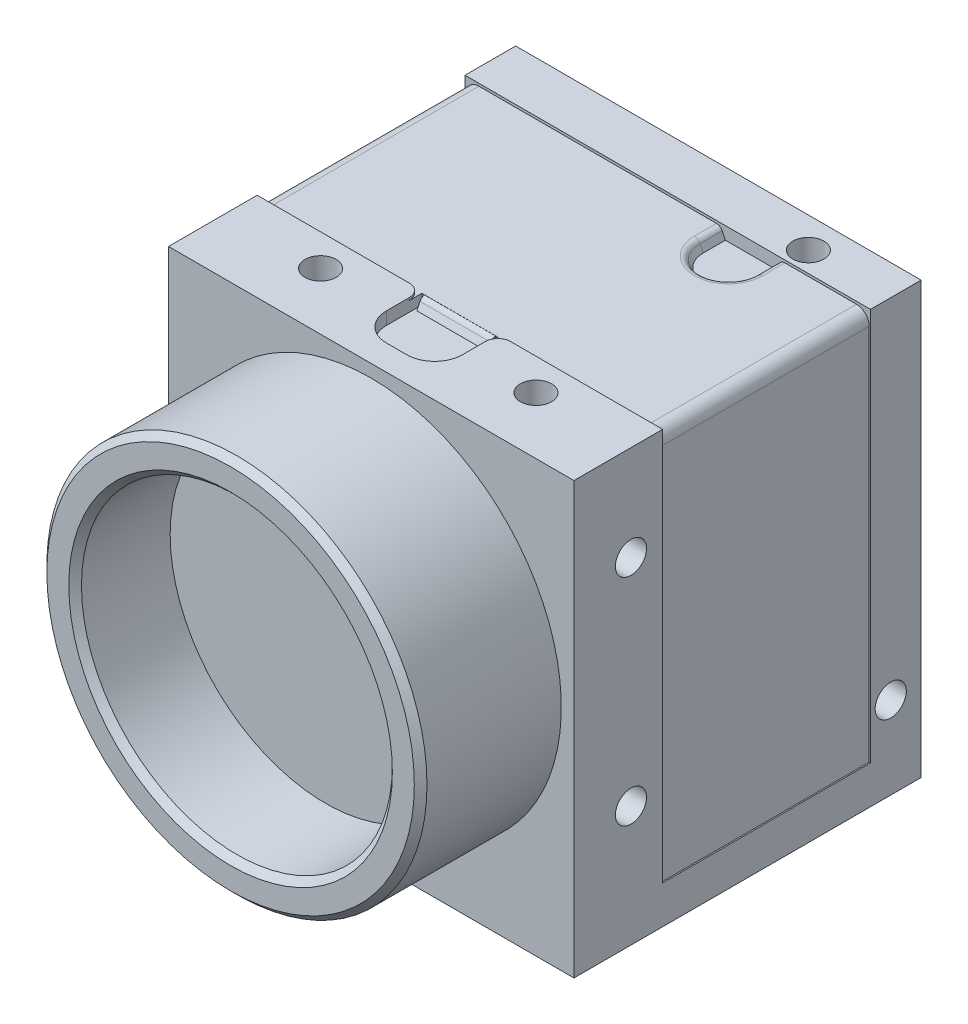
from build123d import *

# Parameters (mm, degrees)
SKETCH1_W                                          = 32
SKETCH1_H                                          = 34
BOSS_EXTRUDE1_DEPTH                                = 27.4
SKETCH2_W                                          = 20.4
SKETCH2_H                                          = 0.2
CUT_EXTRUDE1_DEPTH                                 = 53.304493115
SKETCH3_W                                          = 6
SKETCH3_H                                          = 5
CUT_EXTRUDE2_DEPTH                                 = 0.2
SKETCH4_W                                          = 6
SKETCH4_H                                          = 5
CUT_EXTRUDE3_DEPTH                                 = 0.8
SKETCH5_W                                          = 32
SKETCH5_H                                          = 4
BOSS_EXTRUDE2_DEPTH                                = 0.2
CUT_EXTRUDE4_DEPTH                                 = 0.8
CUT_EXTRUDE5_REACH                                 = 46.359
SKETCH8_W                                          = 0.1
SKETCH8_H                                          = 16.4
CUT_EXTRUDE6_REACH                                 = 46.359
SKETCH10_W                                         = 0.1
SKETCH10_H                                         = 16.4
BOSS_EXTRUDE3_DEPTH                                = 2.8
CUT_EXTRUDE7_DEPTH                                 = 4.8
SKETCH13_W                                         = 27
SKETCH13_H                                         = 10
CUT_EXTRUDE8_DEPTH                                 = 0.5
CUT_EXTRUDE9_DEPTH                                 = 1.8
SKETCH15_W                                         = 8.3
SKETCH15_H                                         = 5.1
CUT_EXTRUDE10_DEPTH                                = 4
DRAFT1_ANGLE                                       = 25.765480369
SKETCH16_W                                         = 15
SKETCH16_H                                         = 11.1
F_2_5_2_5_DIAMETER_HOLE1_D                         = 2.5
F_2_5_2_5_DIAMETER_HOLE1_DEPTH                     = 4
F_1_6_1_6_DIAMETER_HOLE1_D                         = 1.6
F_1_6_1_6_DIAMETER_HOLE1_DEPTH                     = 4
F_6_0_6_DIAMETER_HOLE1_D                           = 6
F_6_0_6_DIAMETER_HOLE1_DEPTH                       = 1.8
HOLE1_D                                            = 1.567
HOLE1_DEPTH                                        = 6.2
HOLE2_D                                            = 1.567
HOLE2_DEPTH                                        = 6.5
M2_CLEARANCE_HOLE1_D                               = 2.459
M2_CLEARANCE_HOLE1_DEPTH                           = 6.5
M2_CLEARANCE_HOLE2_D                               = 2.459
M2_CLEARANCE_HOLE2_DEPTH                           = 6.5
CBORE_FOR_M2_5_HEX_HEAD_MACHINE_SCREW1_D           = 2.8
CBORE_FOR_M2_5_HEX_HEAD_MACHINE_SCREW1_DEPTH       = 4
CBORE_FOR_M2_5_HEX_HEAD_MACHINE_SCREW1_CBORE_D     = 3.2
CBORE_FOR_M2_5_HEX_HEAD_MACHINE_SCREW1_CBORE_DEPTH = 0.45
M2_CLEARANCE_HOLE3_D                               = 2.459
M2_CLEARANCE_HOLE3_DEPTH                           = 38.5
M2_CLEARANCE_HOLE4_D                               = 2.459
M2_CLEARANCE_HOLE4_DEPTH                           = 6.5
M22_CLEARANCE_HOLE1_D                              = 24.5364
M22_CLEARANCE_HOLE1_DEPTH                          = 7.5
RIB1_START                                         = -2.8
RIB1_DEPTH                                         = 5.6
FILLET1_R                                          = 1.35
CHAMFER1_SIZE                                      = 0.5
CHAMFER2_SIZE                                      = 0.3
FILLET2_R                                          = 0.5
FILLET3_R                                          = 1
FILLET4_R                                          = 2
FILLET5_R                                          = 2.2


# Read off the part's stored shape, not the designer's step: Rib1
with BuildPart() as part:
    # Sketch1 → Boss-Extrude1 (new body)
    with BuildSketch(Plane(origin=(0, 0, -27.4), x_dir=(-1, 0, 0), z_dir=(0, 0, -1))):
        with Locations((0, 14)):
            Rectangle(SKETCH1_W, SKETCH1_H)
    extrude(amount=-BOSS_EXTRUDE1_DEPTH)

    # Sketch2 → Cut-Extrude1 (cut, through all)
    with BuildSketch(Plane.ZY.offset(16)):
        with Locations((-17.2, 30.9)):
            Rectangle(SKETCH2_W, SKETCH2_H)
    extrude(amount=-CUT_EXTRUDE1_DEPTH, mode=Mode.SUBTRACT)

    # Sketch3 → Cut-Extrude2 (cut)
    with BuildSketch(Plane(origin=(0, 31, 0), x_dir=(-1, 0, 0), z_dir=(0, 1, 0))):
        with Locations((0, -4.5)):
            Rectangle(SKETCH3_W, SKETCH3_H)
    extrude(amount=-CUT_EXTRUDE2_DEPTH, mode=Mode.SUBTRACT)

    # Sketch4 → Cut-Extrude3 (cut)
    with BuildSketch(Plane(origin=(0, 30.8, 0), x_dir=(-1, 0, 0), z_dir=(0, 1, 0))):
        with Locations((0, -4.5)):
            Rectangle(SKETCH4_W, SKETCH4_H)
    extrude(amount=-CUT_EXTRUDE3_DEPTH, mode=Mode.SUBTRACT)

    # Sketch5 → Boss-Extrude2 (add)
    with BuildSketch(Plane(origin=(0, 30.8, 0), x_dir=(-1, 0, 0), z_dir=(0, 1, 0))):
        with Locations((0, -25.4)):
            Rectangle(SKETCH5_W, SKETCH5_H)
    extrude(amount=BOSS_EXTRUDE2_DEPTH)

    # Sketch6 → Cut-Extrude4 (cut)
    with BuildSketch(Plane(origin=(0, 30.8, 0), x_dir=(-1, 0, 0), z_dir=(0, 1, 0))):
        with BuildLine():
            Line((-8.936140662, -21.65), (-8.936140662, -23.4))
            Line((-8.936140662, -23.4), (-4.163859338, -23.4))
            Line((-4.163859338, -23.4), (-4.163859338, -21.65))
            ThreePointArc((-4.163859338, -21.65), (-6.55, -19.263859338), (-8.936140662, -21.65))
        make_face()
    extrude(amount=-CUT_EXTRUDE4_DEPTH, mode=Mode.SUBTRACT)

    # Sketch8 → Cut-Extrude5 (cut, up to next)
    with BuildSketch(Plane.XZ, mode=Mode.PRIVATE) as cut_extrude5_sk1:
        with Locations((-15.95, -15.2)):
            Rectangle(SKETCH8_W, SKETCH8_H)
    cut_extrude5_tool1 = extrude(cut_extrude5_sk1.sketch, amount=-CUT_EXTRUDE5_REACH, mode=Mode.PRIVATE) & part.part
    add(cut_extrude5_tool1.solids().sort_by_distance((-15.95, 0, -15.2))[0], mode=Mode.SUBTRACT)

    # Sketch10 → Cut-Extrude6 (cut, up to next)
    with BuildSketch(Plane.XZ, mode=Mode.PRIVATE) as cut_extrude6_sk1:
        with Locations((15.95, -15.2)):
            Rectangle(SKETCH10_W, SKETCH10_H)
    cut_extrude6_tool1 = extrude(cut_extrude6_sk1.sketch, amount=-CUT_EXTRUDE6_REACH, mode=Mode.PRIVATE) & part.part
    add(cut_extrude6_tool1.solids().sort_by_distance((15.95, 0, -15.2))[0], mode=Mode.SUBTRACT)

    # Sketch11 → Boss-Extrude3 (add)
    with BuildSketch(Plane(origin=(0, 0, -27.4), x_dir=(-1, 0, 0), z_dir=(0, 0, -1))):
        with BuildLine():
            Line((13.7, 19.69), (13.7, 14.61))
            ThreePointArc((13.7, 14.61), (12.625054144, 12.748076643), (10.47510829, 12.747982865))
            Line((10.47510829, 12.747982865), (8.3, 14.003613559))
            Line((8.3, 14.003613559), (8.3, 20.296386441))
            Line((8.3, 20.296386441), (10.47510829, 21.552017135))
            ThreePointArc((10.47510829, 21.552017135), (12.625054144, 21.551923357), (13.7, 19.69))
        make_face()
    extrude(amount=BOSS_EXTRUDE3_DEPTH)

    # Sketch12 → Cut-Extrude7 (cut)
    with BuildSketch(Plane(origin=(0, 0, -30.2), x_dir=(-1, 0, 0), z_dir=(0, 0, -1))):
        with BuildLine():
            Line((12.9, 14.61), (12.9, 19.69))
            ThreePointArc((12.9, 19.69), (12.225033997, 20.859114666), (10.875067996, 20.85917355))
            Line((10.875067996, 20.85917355), (9.1, 19.834475207))
            Line((9.1, 19.834475207), (9.1, 14.465524793))
            Line((9.1, 14.465524793), (10.875067996, 13.44082645))
            ThreePointArc((10.875067996, 13.44082645), (12.225033997, 13.440885334), (12.9, 14.61))
        make_face()
    extrude(amount=-CUT_EXTRUDE7_DEPTH, mode=Mode.SUBTRACT)

    # Sketch13 → Cut-Extrude8 (cut)
    with BuildSketch(Plane.XZ.offset(3)):
        with Locations((0, -14.5)):
            Rectangle(SKETCH13_W, SKETCH13_H)
    extrude(amount=-CUT_EXTRUDE8_DEPTH, mode=Mode.SUBTRACT)

    # Sketch14 → Cut-Extrude9 (cut)
    with BuildSketch(Plane.XZ.offset(3)):
        with BuildLine():
            Line((3, -27.4), (3, -25))
            ThreePointArc((3, -25), (0, -22), (-3, -25))
            Line((-3, -25), (-3, -27.4))
            Line((-3, -27.4), (3, -27.4))
        make_face()
    extrude(amount=-CUT_EXTRUDE9_DEPTH, mode=Mode.SUBTRACT)

    # Sketch15 → Cut-Extrude10 (cut)
    with BuildSketch(Plane(origin=(0, 0, -27.4), x_dir=(-1, 0, 0), z_dir=(0, 0, -1))):
        with Locations((0, 26.8)):
            Rectangle(SKETCH15_W, SKETCH15_H)
    extrude(amount=-CUT_EXTRUDE10_DEPTH, mode=Mode.SUBTRACT)

    # Draft1
    draft1_faces = [part.faces().sort_by_distance(p)[0] for p in [
        (6.55, 30.4, -19.263859338),
        (8.936140662, 30.4, -22.525),
        (4.163859338, 30.4, -22.525),
    ]]
    draft(draft1_faces, Plane(origin=(16, 30.8, -27.4), x_dir=(0, 0, 1), z_dir=(0, 1, 0)), DRAFT1_ANGLE)

    # Sketch16 → Revolve1 (revolve)
    with BuildSketch(Plane.XZ.offset(-15), mode=Mode.PRIVATE) as revolve1_sk:
        with Locations((7.5, 5.55)):
            Rectangle(SKETCH16_W, SKETCH16_H)
    revolve(revolve1_sk.sketch.rotate(Axis((0, 15, 11.1), (0, 0, -1)), 270), axis=Axis((0, 15, 11.1), (0, 0, -1)))

    # Ø2.5 (2.5) Diameter Hole1
    with Locations(Plane(origin=(0, 0, -27.4), x_dir=(-1, 0, 0), z_dir=(0, 0, -1))):
        with Locations((-1.6, 13.05)):
            Hole(F_2_5_2_5_DIAMETER_HOLE1_D / 2, depth=F_2_5_2_5_DIAMETER_HOLE1_DEPTH)

    # Ø1.6 (1.6) Diameter Hole1
    with Locations(Plane(origin=(0, 0, -27.4), x_dir=(-1, 0, 0), z_dir=(0, 0, -1))):
        with Locations((11, 24.325), (11, 9.975)):
            Hole(F_1_6_1_6_DIAMETER_HOLE1_D / 2, depth=F_1_6_1_6_DIAMETER_HOLE1_DEPTH)

    # Ø6.0 (6) Diameter Hole1
    with Locations(Plane.XZ.offset(3)):
        with Locations((0, -4)):
            Hole(F_6_0_6_DIAMETER_HOLE1_D / 2, depth=F_6_0_6_DIAMETER_HOLE1_DEPTH)

    # Hole1
    with Locations(Plane.XZ.offset(3)):
        with Locations((-6, -24.5), (6, -24.5)):
            Hole(HOLE1_D / 2, depth=HOLE1_DEPTH)

    # Hole2
    with Locations(Plane.XZ.offset(3)):
        with Locations((6, -2.5), (-6, -2.5)):
            Hole(HOLE2_D / 2, depth=HOLE2_DEPTH)

    # M2 Clearance Hole1
    with Locations(Plane(origin=(16, 0, 0), x_dir=(0, 0, -1), z_dir=(1, 0, 0))):
        with Locations((4.5, 6.5)):
            Hole(M2_CLEARANCE_HOLE1_D / 2, depth=M2_CLEARANCE_HOLE1_DEPTH)

    # M2 Clearance Hole2
    with Locations(Plane.XZ.offset(3)):
        with Locations((-9.5, -25), (9.5, -25), (8.5, -4.5), (-8.5, -4.5)):
            Hole(M2_CLEARANCE_HOLE2_D / 2, depth=M2_CLEARANCE_HOLE2_DEPTH)

    # CBORE for M2.5 Hex Head Machine Screw1
    with Locations(Plane(origin=(0, 0, -27.4), x_dir=(-1, 0, 0), z_dir=(0, 0, -1))):
        with Locations((-6.9, 23.25)):
            CounterBoreHole(CBORE_FOR_M2_5_HEX_HEAD_MACHINE_SCREW1_D / 2, CBORE_FOR_M2_5_HEX_HEAD_MACHINE_SCREW1_CBORE_D / 2, CBORE_FOR_M2_5_HEX_HEAD_MACHINE_SCREW1_CBORE_DEPTH, depth=CBORE_FOR_M2_5_HEX_HEAD_MACHINE_SCREW1_DEPTH)

    # M2 Clearance Hole3
    with Locations(Plane.ZY.offset(16)):
        with Locations((-4.5, 23.5), (-4.5, 6.5), (-25, 3.5)):
            Hole(M2_CLEARANCE_HOLE3_D / 2, depth=M2_CLEARANCE_HOLE3_DEPTH)

    # M2 Clearance Hole4
    with Locations(Plane(origin=(0, 31, 0), x_dir=(-1, 0, 0), z_dir=(0, 1, 0))):
        with Locations((8.5, -4.5), (-8.5, -4.5), (-9.5, -25)):
            Hole(M2_CLEARANCE_HOLE4_D / 2, depth=M2_CLEARANCE_HOLE4_DEPTH)

    # M22 Clearance Hole1
    with Locations(Plane.XY.offset(11.1)):
        with Locations((0, 15)):
            Hole(M22_CLEARANCE_HOLE1_D / 2, depth=M22_CLEARANCE_HOLE1_DEPTH)

    # Rib1 outline → Rib1 (add)
    with BuildSketch(Plane(origin=(0, 0, 0), x_dir=(0, 0, -1), z_dir=(1, 0, 0)).offset(RIB1_START)):
        with BuildLine():
            ThreePointArc((7, 30.789897949), (6.792955609, 30.694618477), (6.649709587, 30.517344298))
            Line((6.649709587, 30.517344298), (6.4, 30))
            Line((6.4, 30), (7, 30))
            Line((7, 30), (7, 30.789897949))
        make_face()
    extrude(amount=RIB1_DEPTH)

    # Fillet1
    fillet1_edges = [part.edges().sort_by_distance(p)[0] for p in [
        (-9.1, 14.465524793, -27.8),
        (-9.1, 19.834475207, -27.8),
    ]]
    fillet(fillet1_edges, radius=FILLET1_R)

    # Chamfer1
    chamfer1_edges = [part.edges().sort_by_distance(p)[0] for p in [
        (0, 0, 11.1),
        (12.2682, 15, 11.1),
    ]]
    chamfer(chamfer1_edges, length=CHAMFER1_SIZE)

    # Chamfer2
    chamfer2_edges = [part.edges().sort_by_distance(p)[0] for p in [
        (-12.225033997, 13.440885334, -30.2),
        (-12.9, 17.15, -30.2),
        (-12.225033997, 20.859114666, -30.2),
        (-10.325067996, 20.54167355, -30.2),
        (-9.1, 17.15, -30.2),
        (-10.325067996, 13.75832645, -30.2),
        (-9.280885334, 19.730033997, -30.2),
        (-9.280885334, 14.569966003, -30.2),
    ]]
    chamfer(chamfer2_edges, length=CHAMFER2_SIZE)

    # Fillet2
    fillet2_edges = [part.edges().sort_by_distance(p)[0] for p in [
        (6.55, 30.8, -19.263859338),
        (8.936140662, 30.8, -22.525),
        (4.163859338, 30.8, -22.525),
    ]]
    fillet(fillet2_edges, radius=FILLET2_R)

    # Fillet3
    fillet3_edges = [part.edges().sort_by_distance(p)[0] for p in [
        (-4.15, 24.25, -25.4),
        (4.15, 24.25, -25.4),
        (4.15, 29.35, -25.4),
        (-4.15, 29.35, -25.4),
        (-3, 30.9, -7),
        (3, 30.9, -7),
        (-15.9, 30.8, -15.2),
        (15.9, 30.8, -15.2),
    ]]
    fillet(fillet3_edges, radius=FILLET3_R)

    # Fillet4
    fillet4_edges = [part.edges().sort_by_distance(p)[0] for p in [
        (13.5, -2.75, -9.5),
        (13.5, -2.75, -19.5),
        (-13.5, -2.75, -19.5),
        (-13.5, -2.75, -9.5),
    ]]
    fillet(fillet4_edges, radius=FILLET4_R)

    # Fillet5
    fillet5_edges = [part.edges().sort_by_distance(p)[0] for p in [
        (-8.3, 20.296386441, -28.8),
        (-8.3, 14.003613559, -28.8),
        (3, 30.5, -2),
        (-3, 30.5, -2),
    ]]
    fillet(fillet5_edges, radius=FILLET5_R)


solid = part.part
